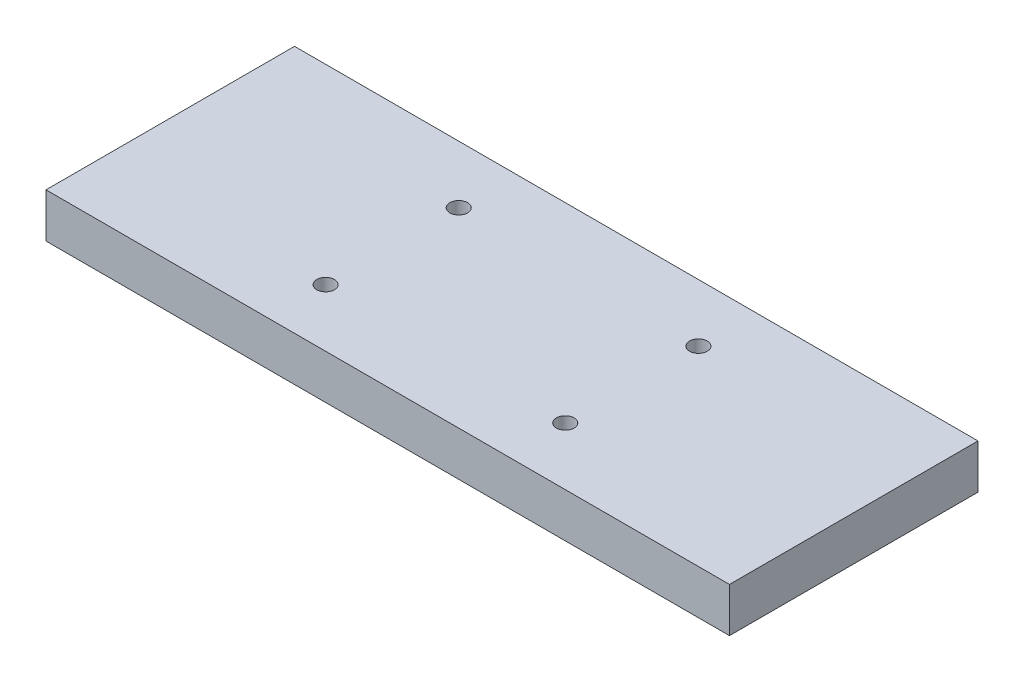
from build123d import *

# Parameters (mm, degrees)
SKETCH1_W                 = 154
SKETCH1_H                 = 56
BOSS_EXTRUDE1_DEPTH       = 10
F_4_0MM_DOWEL_HOLE2_D     = 4
F_4_0MM_DOWEL_HOLE2_DEPTH = 6
F_4_0MM_DOWEL_HOLE2_TIP   = 1.201721238


with BuildPart() as part:
    # Sketch1 → Boss-Extrude1 (new body)
    with BuildSketch(Plane(origin=(0, 0, 0), x_dir=(1, 0, 0), z_dir=(0, 1, 0))):
        Rectangle(SKETCH1_W, SKETCH1_H)
    extrude(amount=BOSS_EXTRUDE1_DEPTH)

    # Ø4.0mm Dowel Hole2
    with Locations(Plane(origin=(-27, 10, -15), x_dir=(0, 0, 1), z_dir=(0, 1, 0))):
        with Locations((0, 0), (30, 0), (30, 54), (0, 54)):
            Hole(F_4_0MM_DOWEL_HOLE2_D / 2, depth=F_4_0MM_DOWEL_HOLE2_DEPTH)
            with Locations((0, 0, -(F_4_0MM_DOWEL_HOLE2_DEPTH + F_4_0MM_DOWEL_HOLE2_TIP / 2))):  # 118° drill point
                Cone(0, F_4_0MM_DOWEL_HOLE2_D / 2, F_4_0MM_DOWEL_HOLE2_TIP, mode=Mode.SUBTRACT)


solid = part.part
